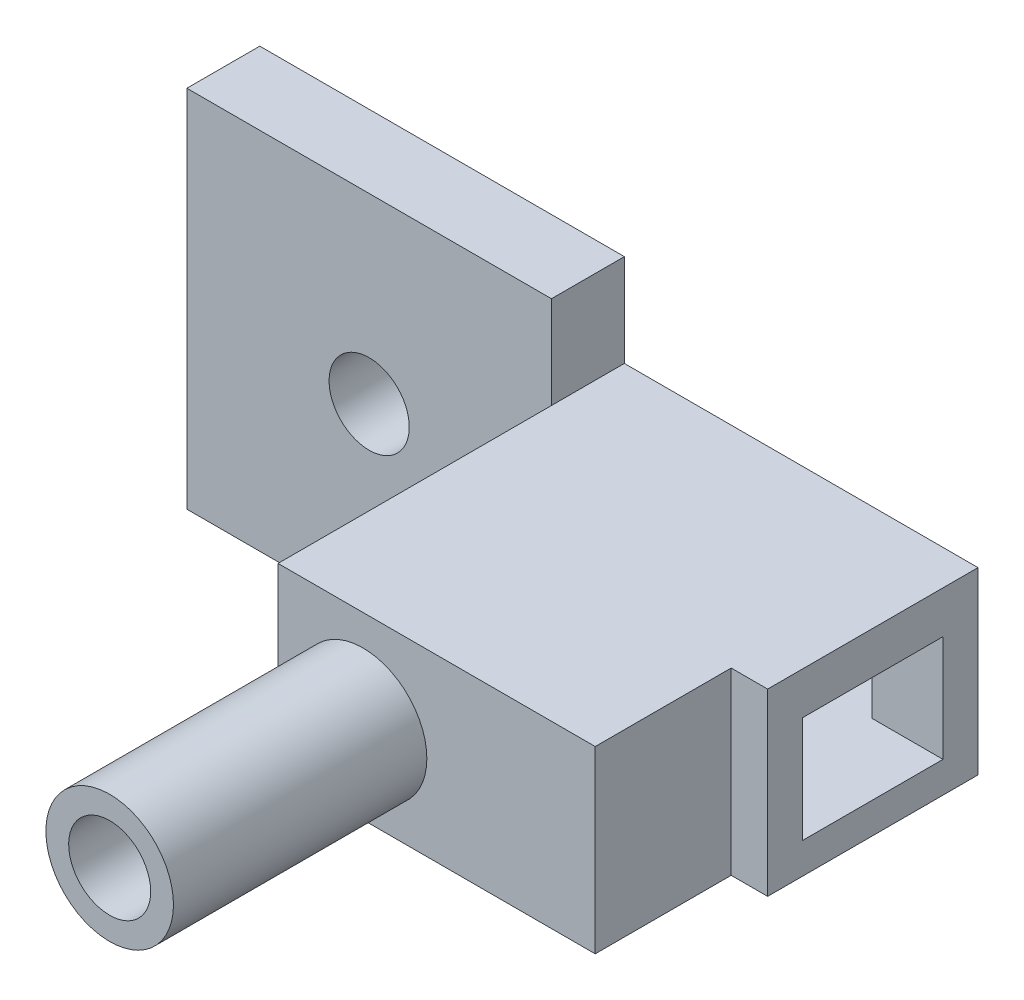
from build123d import *

# Parameters (mm, degrees)
SKETCH1_W           = 17.4
SKETCH1_H           = 9.850463562
BOSS_EXTRUDE1_DEPTH = 2
BOSS_EXTRUDE2_START = 1.9
SKETCH1_4_R         = 2.25
BOSS_EXTRUDE2_DEPTH = 14
SKETCH2_W           = 17.4
SKETCH2_H           = 9.850463562
BOSS_EXTRUDE3_DEPTH = 17
SKETCH4_W           = 7.7
SKETCH4_H           = 5.83
CUT_EXTRUDE1_DEPTH  = 1.9
SKETCH5_W           = 20
SKETCH5_H           = 20
SKETCH5_R           = 2.2
BOSS_EXTRUDE4_DEPTH = 4
CHAMFER1_SIZE       = 0.5
SKETCH6_W           = 11.54
SKETCH6_H           = 9.850463562
SKETCH6_W_2         = 7.7
SKETCH6_H_2         = 5.83
BOSS_EXTRUDE5_DEPTH = 2


with BuildPart() as part:
    # Sketch1 → Boss-Extrude1 (new body)
    with BuildSketch(Plane.XY):
        with Locations((6.7, 2.924768219)):
            Rectangle(SKETCH1_W, SKETCH1_H)
        with BuildLine():
            Line((0, 0.396129135), (0, 4.933870865))
            ThreePointArc((0, 4.933870865), (0.190126266, 5.139873734), (0.396129135, 5.33))
            Line((0.396129135, 5.33), (4.933870865, 5.33))
            ThreePointArc((4.933870865, 5.33), (6.165, 2.665), (4.933870865, 0))
            Line((4.933870865, 0), (0.396129135, 0))
            ThreePointArc((0.396129135, 0), (0.190126266, 0.190126266), (0, 0.396129135))
        make_face(mode=Mode.SUBTRACT)
    extrude(amount=BOSS_EXTRUDE1_DEPTH)

    # Sketch1<4> → Boss-Extrude2 (add)
    # profile 1 of 4: a face of its own
    with BuildSketch(Plane.XY.offset(BOSS_EXTRUDE2_START)):
        with BuildLine():
            ThreePointArc((0.396129135, 5.33), (0.190126266, 5.139873734), (0, 4.933870865))
            Line((0, 4.933870865), (0, 0.396129135))
            ThreePointArc((0, 0.396129135), (0.190126266, 0.190126266), (0.396129135, 0))
            Line((0.396129135, 0), (4.933870865, 0))
            ThreePointArc((4.933870865, 0), (5.842345435, 1.197186665), (6.165, 2.665))
            ThreePointArc((6.165, 2.665), (5.842345435, 4.132813335), (4.933870865, 5.33))
            Line((4.933870865, 5.33), (0.396129135, 5.33))
        make_face()
        with Locations((2.665, 2.665)):
            Circle(SKETCH1_4_R, mode=Mode.SUBTRACT)
    # profile 2 of 4: a face of its own
    with BuildSketch(Plane.XY.offset(BOSS_EXTRUDE2_START)):
        with BuildLine():
            Line((0, 0.396129135), (0, 4.933870865))
            ThreePointArc((0, 4.933870865), (-0.835, 2.665), (0, 0.396129135))
        make_face()
    # profile 3 of 4: a face of its own
    with BuildSketch(Plane.XY.offset(BOSS_EXTRUDE2_START)):
        with BuildLine():
            ThreePointArc((4.933870865, 5.33), (2.665, 6.165), (0.396129135, 5.33))
            Line((0.396129135, 5.33), (4.933870865, 5.33))
        make_face()
    # profile 4 of 4: a face of its own
    with BuildSketch(Plane.XY.offset(BOSS_EXTRUDE2_START)):
        with BuildLine():
            Line((4.933870865, 0), (0.396129135, 0))
            ThreePointArc((0.396129135, 0), (2.665, -0.835), (4.933870865, 0))
        make_face()
    extrude(amount=BOSS_EXTRUDE2_DEPTH)

    # Sketch2 → Boss-Extrude3 (add)
    with BuildSketch(Plane(origin=(0, 0, 0), x_dir=(-1, 0, 0), z_dir=(0, 0, -1))):
        with Locations((-6.7, 2.924768219)):
            Rectangle(SKETCH2_W, SKETCH2_H)
        Polygon((-13.5, 5.53), (-11.88, 5.53), (-11.88, 7.05), (-9.28, 7.05), (-9.28, 5.63), (-4.12, 5.63), (-4.12, 7.05), (-1.52, 7.05), (-1.52, 5.63), (0.1, 5.63), (0.1, -0.3), (-13.5, -0.3), align=None, mode=Mode.SUBTRACT)
    extrude(amount=BOSS_EXTRUDE3_DEPTH)

    # Sketch4 → Cut-Extrude1 (cut)
    with BuildSketch(Plane.ZY.offset(-13.5)):
        with Locations((-11.23, 2.615)):
            Rectangle(SKETCH4_W, SKETCH4_H)
    extrude(amount=-CUT_EXTRUDE1_DEPTH, mode=Mode.SUBTRACT)

    # Sketch5 → Boss-Extrude4 (add)
    with BuildSketch(Plane(origin=(0, 0, -17), x_dir=(-1, 0, 0), z_dir=(0, 0, -1))):
        with Locations((12, 2.924768219)):
            Rectangle(SKETCH5_W, SKETCH5_H)
        with Locations((12, 2.924768219)):
            Circle(SKETCH5_R, mode=Mode.SUBTRACT)
    extrude(amount=-BOSS_EXTRUDE4_DEPTH)

    # Chamfer1
    # the kernel refuses this chamfer: 0.5 mm, written as the material it adds along each edge
    with BuildSketch(Plane(origin=(0, -0.889712359, 1.9), x_dir=(-0.027495876610586365, 0, -0.9996219169112968), z_dir=(0, 1, 0))) as chamfer1_piece_1_section:
        Polygon((CHAMFER1_SIZE * 0.999621916911, -CHAMFER1_SIZE * 0.0274958766106), (-CHAMFER1_SIZE * 0.0274958766106, -CHAMFER1_SIZE * 0.999621916911), (0, 0), align=None)
    chamfer1_piece_1 = extrude(amount=7.109424717, mode=Mode.PRIVATE)
    chamfer1_piece_1 = chamfer1_piece_1 - Plane(origin=(2.665, 2.665, 1.727474794), x_dir=(1, 0, 0), z_dir=(0, 0, -1)) * Cylinder(2.25, 17, mode=Mode.PRIVATE)
    add(chamfer1_piece_1)
    with BuildSketch(Plane(origin=(-0.889712359, 5.33, 1.9), x_dir=(0, 0.027495876610585623, -0.9996219169112968), z_dir=(1, 0, 0))) as chamfer1_piece_2_section:
        Polygon((CHAMFER1_SIZE * 0.999621916911, -CHAMFER1_SIZE * 0.0274958766106), (-CHAMFER1_SIZE * 0.0274958766106, -CHAMFER1_SIZE * 0.999621916911), (0, 0), align=None)
    chamfer1_piece_2 = extrude(amount=7.109424717, mode=Mode.PRIVATE)
    chamfer1_piece_2 = chamfer1_piece_2 - Plane(origin=(2.665, 2.665, 1.727474794), x_dir=(1, 0, 0), z_dir=(0, 0, -1)) * Cylinder(2.25, 17, mode=Mode.PRIVATE)
    add(chamfer1_piece_2)
    with BuildSketch(Plane(origin=(6.219712359, 0, 1.9), x_dir=(0, -0.027495876610586365, -0.9996219169112968), z_dir=(-1, 0, 0))) as chamfer1_piece_3_section:
        Polygon((CHAMFER1_SIZE * 0.999621916911, -CHAMFER1_SIZE * 0.0274958766106), (-CHAMFER1_SIZE * 0.0274958766106, -CHAMFER1_SIZE * 0.999621916911), (0, 0), align=None)
    chamfer1_piece_3 = extrude(amount=7.109424717, mode=Mode.PRIVATE)
    chamfer1_piece_3 = chamfer1_piece_3 - Plane(origin=(2.665, 2.665, 1.727474794), x_dir=(1, 0, 0), z_dir=(0, 0, -1)) * Cylinder(2.25, 17, mode=Mode.PRIVATE)
    add(chamfer1_piece_3)
    with BuildSketch(Plane(origin=(2.665, 2.665, 1.9), x_dir=(-0.9434537391287974, -0.3315042113215022, 0), z_dir=(-0.3315042113215022, 0.9434537391287974, 0))) as chamfer1_piece_4:
        Polygon((3.5, -CHAMFER1_SIZE), (3.5 - CHAMFER1_SIZE, 0), (3.5, 0), align=None)
    revolve(axis=Axis((2.665, 2.665, 1.9), (0, 0, 1)), revolution_arc=51.27979911)
    with BuildSketch(Plane(origin=(2.665, 2.665, 1.9), x_dir=(0.33133655383280003, -0.943512632715749, 0), z_dir=(-0.943512632715749, -0.33133655383280003, 0))) as chamfer1_piece_5:
        Polygon((3.5, -CHAMFER1_SIZE), (3.5 - CHAMFER1_SIZE, 0), (3.5, 0), align=None)
    revolve(axis=Axis((2.665, 2.665, 1.9), (0, 0, 1)), revolution_arc=141.300162094)
    with BuildSketch(Plane(origin=(2.665, 2.665, 1.9), x_dir=(-0.33150421132149205, 0.9434537391288009, 0), z_dir=(0.9434537391288009, 0.33150421132149205, 0))) as chamfer1_piece_6:
        Polygon((3.5, -CHAMFER1_SIZE), (3.5 - CHAMFER1_SIZE, 0), (3.5, 0), align=None)
    revolve(axis=Axis((2.665, 2.665, 1.9), (0, 0, 1)), revolution_arc=51.27979911)

    # Sketch6 → Boss-Extrude5 (add)
    with BuildSketch(Plane(origin=(15.4, 0, 0), x_dir=(0, 0, -1), z_dir=(1, 0, 0))):
        with Locations((11.23, 2.924768219)):
            Rectangle(SKETCH6_W, SKETCH6_H)
        with Locations((11.23, 2.615)):
            Rectangle(SKETCH6_W_2, SKETCH6_H_2, mode=Mode.SUBTRACT)
    extrude(amount=BOSS_EXTRUDE5_DEPTH)


solid = part.part
